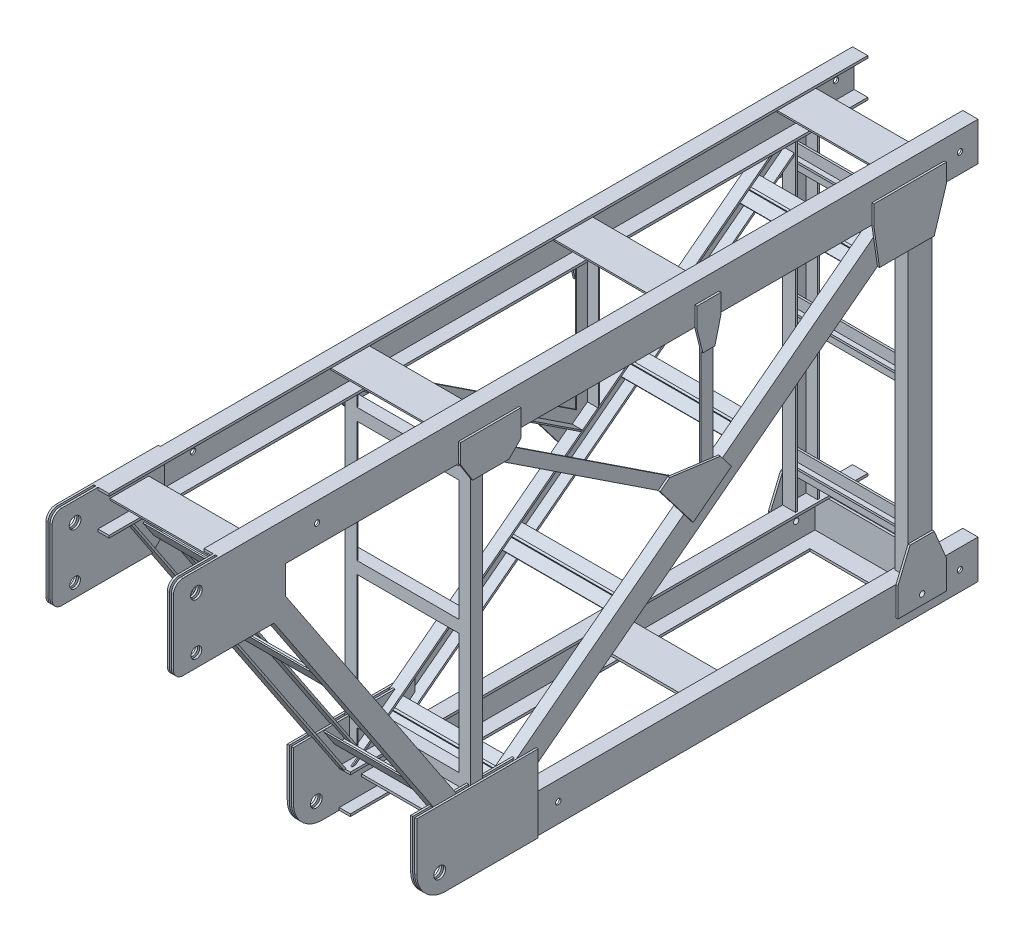
from build123d import *

# Parameters (mm, degrees)
EXTRUDE_1_DEPTH                   = 3335
EXTRUDE_1_2_DEPTH                 = 3335
PATTERN_LINEAR_2_COUNT            = 2
PATTERN_LINEAR_2_PITCH            = 1500
SKETCH_4_W                        = 520
SKETCH_4_H                        = 1000
CUT_EXTRUDE_2_DEPTH               = 1000
EXTRUDE_3_DEPTH                   = 520
SKETCH_8_W                        = 100
SKETCH_8_H                        = 1340
EXTRUDE_7_DEPTH                   = 520
CUT_EXTRUDE_9_DEPTH               = 1340
SKETCH_11_R                       = 11
CUT_EXTRUDE_10_DEPTH              = 3694.592424727
EXTRUDE_11_DEPTH                  = 48
PATTERN_LINEAR_3_COUNT            = 2
PATTERN_LINEAR_3_PITCH            = 472
CUT_EXTRUDE_12_DEPTH              = 42.7
CUT_EXTRUDE_13_DEPTH              = 42.7
EXTRUDE_14_DEPTH                  = 43
PATTERN_LINEAR_4_COUNT            = 2
PATTERN_LINEAR_4_PITCH            = 477
CUT_EXTRUDE_15_DEPTH              = 38
CUT_EXTRUDE_16_DEPTH              = 38
EXTRUDE_17_DEPTH                  = 520
SKETCH_19_W                       = 394
SKETCH_19_H                       = 50
CUT_EXTRUDE_18_DEPTH              = 3694.592424727
CUT_EXTRUDE_19_DEPTH              = 15
CUT_EXTRUDE_20_DEPTH              = 15
CUT_EXTRUDE_21_DEPTH              = 45
CUT_EXTRUDE_22_DEPTH              = 45
PATTERN_LINEAR_6_COUNT            = 4
PATTERN_LINEAR_6_PITCH            = 925
SKETCH_27_W                       = 520
SKETCH_27_H                       = 160
EXTRUDE_24_DEPTH                  = 10
SKETCH_28_W                       = 507
SKETCH_28_H                       = 10
EXTRUDE_25_DEPTH                  = 140
EXTRUDE_26_DEPTH                  = 520
PATTERN_LINEAR_9_COUNT            = 3
PATTERN_LINEAR_9_PITCH            = 550
EXTRUDE_27_DEPTH                  = 520
PATTERN_LINEAR_10_COUNT           = 4
PATTERN_LINEAR_10_PITCH           = 620
EXTRUDE_28_DEPTH                  = 520
SKETCH_32_W                       = 394
SKETCH_32_H                       = 5
EXTRUDE_29_DEPTH                  = 15
PATTERN_LINEAR_11_COUNT           = 3
PATTERN_LINEAR_11_PITCH           = 675
SKETCH_38_W                       = 520
SKETCH_38_H                       = 50
EXTRUDE_36_DEPTH                  = 50
SKETCH_38_2_W                     = 520
SKETCH_38_2_H                     = 50
EXTRUDE_37_DEPTH                  = 50
PATTERN_LINEAR_13_COUNT           = 3
PATTERN_LINEAR_13_PITCH           = 550
SKETCH_39_W                       = 514
SKETCH_39_H                       = 45
CUT_EXTRUDE_38_DEPTH              = 45
SKETCH_40_W                       = 503.521126761
SKETCH_40_H                       = 320
EXTRUDE_39_DEPTH                  = 8.5
PATTERN_LINEAR_15_COUNT           = 2
PATTERN_LINEAR_15_PITCH           = 17
PATTERN_LINEAR_16_COUNT           = 2
PATTERN_LINEAR_16_PITCH           = 511.5
PATTERN_LINEAR_16_COPY_1_SKETCH_W = 503.521126761
PATTERN_LINEAR_16_COPY_1_SKETCH_H = 320
PATTERN_LINEAR_16_COPY_1_DEPTH    = 8.5
SKETCH_41_W                       = 8.5
SKETCH_41_H                       = 160
SKETCH_41_W_2                     = 486
CUT_EXTRUDE_40_DEPTH              = 190
SKETCH_42_W                       = 160
SKETCH_42_H                       = 10
EXTRUDE_41_DEPTH                  = 501.5
FILLET_1_R                        = 120
SKETCH_43_R                       = 24.25
CUT_EXTRUDE_42_DEPTH              = 3697.024080008
SKETCH_44_W                       = 465
SKETCH_44_H                       = 350
EXTRUDE_43_DEPTH                  = 8.5
PATTERN_LINEAR_17_COUNT           = 2
PATTERN_LINEAR_17_PITCH           = 17
SKETCH_45_W                       = 8.5
SKETCH_45_H                       = 350
SKETCH_45_W_2                     = 496.5
CUT_EXTRUDE_44_DEPTH              = 190
CHAMFER_1_SIZE                    = 50
SKETCH_46_R                       = 24.25
CUT_EXTRUDE_45_DEPTH              = 3697.024080008
EXTRUDE_46_DEPTH                  = 8.5
PATTERN_LINEAR_19_COUNT           = 2
PATTERN_LINEAR_19_PITCH           = 528.5
PATTERN_LINEAR_20_COUNT           = 2
PATTERN_LINEAR_20_PITCH           = 950
EXTRUDE_48_DEPTH                  = 50
EXTRUDE_55_DEPTH                  = 50
PATTERN_LINEAR_21_COUNT           = 2
PATTERN_LINEAR_21_PITCH           = 470
CUT_EXTRUDE_56_DEPTH              = 45
CUT_EXTRUDE_57_DEPTH              = 45
CHAMFER_2_SIZE                    = 50
EXTRUDE_58_DEPTH                  = 8.5
PATTERN_LINEAR_22_COUNT           = 2
PATTERN_LINEAR_22_PITCH           = 528.5
CHAMFER_3_SIZE                    = 150
PATTERN_LINEAR_23_COUNT           = 2
PATTERN_LINEAR_23_PITCH           = 520
PATTERN_LINEAR_24_COUNT           = 2
PATTERN_LINEAR_24_PITCH           = 503
SKETCH_57_R                       = 24.25
SKETCH_57_R_2                     = 22.25
CUT_EXTRUDE_59_DEPTH              = 3695.798675165
FILLET_2_R                        = 40
SKETCH_58_R                       = 11
CUT_EXTRUDE_60_DEPTH              = 3697.024080008


with BuildPart() as part:
    # 草图2 → 拉伸1 (new body)
    with BuildSketch(Plane.XY):
        Polygon((0, 0), (0, 160), (63, 160), (63, 150), (6.5, 150), (6.5, 10), (63, 10), (63, 0), align=None)
    extrude_1 = extrude(amount=EXTRUDE_1_DEPTH)



with BuildPart() as body_2:
    # 草图2 → Extrude 1 2 (new body)
    with BuildSketch(Plane.XY):
        Polygon((457, 160), (520, 160), (520, 0), (457, 0), (457, 10), (513.5, 10), (513.5, 150), (457, 150), align=None)
    extrude_1_2 = extrude(amount=EXTRUDE_1_2_DEPTH)


with BuildPart() as pattern_linear_2_1:
    # 阵列(线性)2: pattern copy
    add(extrude_1.moved(Location(Vector(0, -1, 0) * (1 * PATTERN_LINEAR_2_PITCH))))


with BuildPart() as pattern_linear_2_2:
    # 阵列(线性)2: pattern copy
    add(extrude_1_2.moved(Location(Vector(0, -1, 0) * (1 * PATTERN_LINEAR_2_PITCH))))


with BuildPart() as cut_extrude_2_tool:
    # 草图4 → 拉伸2 (new body)
    with BuildSketch(Plane(origin=(0, -1340, 0), x_dir=(1, 0, 0), z_dir=(0, 1, 0))):
        with Locations((260, -2835)):
            Rectangle(SKETCH_4_W, SKETCH_4_H)
    extrude(amount=-CUT_EXTRUDE_2_DEPTH)


with BuildPart() as pattern_linear_2_1_1:
    add(pattern_linear_2_1.part)

    # 拉伸2: cut by cut_extrude_2_tool
    add(cut_extrude_2_tool.part, mode=Mode.SUBTRACT)


with BuildPart() as pattern_linear_2_2_1:
    add(pattern_linear_2_2.part)

    # 拉伸2: cut by cut_extrude_2_tool
    add(cut_extrude_2_tool.part, mode=Mode.SUBTRACT)


with BuildPart() as part_1:
    add(part.part)

    add(body_2.part)  # 拉伸3 merges body 2
    # 草图5 → 拉伸3 (add)
    with BuildSketch(Plane.ZY):
        Polygon((160, 95), (320, 95), (320, 88.5), (243.25, 88.5), (243.25, 48.5), (236.75, 48.5), (236.75, 88.5), (160, 88.5), align=None)
    extrude_3 = extrude(amount=-EXTRUDE_3_DEPTH)

    # 草图11 → 拉伸10 (cut, through all)
    with BuildSketch(Plane.ZY):
        with Locations((3240, 80)):
            Circle(SKETCH_11_R)
    extrude(amount=-CUT_EXTRUDE_10_DEPTH, mode=Mode.SUBTRACT)


    add(pattern_linear_2_1_1.part)  # 拉伸11 merges 阵列(线性)2_1


with BuildPart() as body_4:
    # 草图8 → 拉伸7 (new body)
    with BuildSketch(Plane.ZY):
        with Locations((240, -670)):
            Rectangle(SKETCH_8_W, SKETCH_8_H)
    extrude(amount=-EXTRUDE_7_DEPTH)

    # 草图10 → 拉伸9 (cut)
    with BuildSketch(Plane.XZ.offset(1340)):
        Polygon((466.7, 290), (466.7, 281.5), (514.7, 281.5), (514.7, 198.5), (466.7, 198.5), (466.7, 190), (53.3, 190), (53.3, 198.5), (5.3, 198.5), (5.3, 281.5), (53.3, 281.5), (53.3, 290), align=None)
    extrude(amount=-CUT_EXTRUDE_9_DEPTH, mode=Mode.SUBTRACT)


with BuildPart() as cut_extrude_9_piece_1:
    # of the separate pieces the step leaves, piece 1, a body of its own (cut_extrude_9_pieces)
    add(body_4.part.solids().sort_by_distance((466.7, 0, 198.5))[0])


with BuildPart() as cut_extrude_9_piece_2:
    # of the separate pieces the step leaves, piece 2, a body of its own (cut_extrude_9_pieces)
    add(body_4.part.solids().sort_by_distance((0, 0, 190))[0])


with BuildPart() as part_2:
    add(part_1.part)

    add(cut_extrude_9_piece_2.part)  # 拉伸11 merges 拉伸9 piece 2
    # 草图12 → 拉伸11 (add)
    with BuildSketch(Plane.ZY):
        Polygon((290, 0), (372.257507922, 0), (2122.750465669, -1340), (1958.235449824, -1340), (290, -62.968011455), align=None)
    extrude_11 = extrude(amount=-EXTRUDE_11_DEPTH)


    add(pattern_linear_2_2_1.part)  # 阵列(线性)3 merges 阵列(线性)2_2

    add(cut_extrude_9_piece_1.part)  # 阵列(线性)3 merges 拉伸9 piece 1
    # 阵列(线性)3: 拉伸11 ×2
    with Locations(*[(i * PATTERN_LINEAR_3_PITCH, 0, 0) for i in range(1, PATTERN_LINEAR_3_COUNT)]):
        add(extrude_11)

    # 草图13 → 拉伸12 (cut)
    with BuildSketch(Plane(origin=(48, 0, 0), x_dir=(0, 0, -1), z_dir=(1, 0, 0))):
        Polygon((-358.273731576, 0), (-290, 0), (-290, -52.263449508), (-1972.219226171, -1340), (-2108.766689322, -1340), align=None)
    extrude(amount=-CUT_EXTRUDE_12_DEPTH, mode=Mode.SUBTRACT)

    # 草图14 → 拉伸13 (cut)
    with BuildSketch(Plane.ZY.offset(-472)):
        Polygon((290, -52.263449508), (290, 0), (358.273731576, 0), (2108.766689322, -1340), (1972.219226171, -1340), align=None)
    extrude(amount=-CUT_EXTRUDE_13_DEPTH, mode=Mode.SUBTRACT)

    # 草图15 → 拉伸14 (add)
    with BuildSketch(Plane.ZY):
        Polygon((2996.666666667, 0), (2948.59264966, 0), (2078.064178211, -1305.792707175), (2122.750465669, -1340), (2151.40735034, -1340), (3044.740683673, 0), align=None)
    extrude_14 = extrude(amount=-EXTRUDE_14_DEPTH)

    # 阵列(线性)4: 拉伸14 ×2
    with Locations(*[(i * PATTERN_LINEAR_4_PITCH, 0, 0) for i in range(1, PATTERN_LINEAR_4_COUNT)]):
        add(extrude_14)

    # 草图16 → 拉伸15 (cut)
    with BuildSketch(Plane.ZY.offset(-477)):
        Polygon((2958.207453062, 0), (3035.125880272, 0), (2141.792546938, -1340), (2064.874119728, -1340), align=None)
    extrude(amount=-CUT_EXTRUDE_15_DEPTH, mode=Mode.SUBTRACT)

    # 草图17 → 拉伸16 (cut)
    with BuildSketch(Plane(origin=(43, 0, 0), x_dir=(0, 0, -1), z_dir=(1, 0, 0))):
        Polygon((-3035.125880272, 0), (-2958.207453062, 0), (-2064.874119728, -1340), (-2141.792546938, -1340), align=None)
    extrude(amount=-CUT_EXTRUDE_16_DEPTH, mode=Mode.SUBTRACT)

    # 阵列(线性)6: 拉伸3 ×4
    with Locations(*[(0, 0, i * PATTERN_LINEAR_6_PITCH) for i in range(1, PATTERN_LINEAR_6_COUNT)]):
        add(extrude_3)

    # 草图27 → 拉伸24 (add)
    with BuildSketch(Plane.XZ.offset(1500)):
        with Locations((260, 160)):
            Rectangle(SKETCH_27_W, SKETCH_27_H)
    extrude(amount=-EXTRUDE_24_DEPTH)

    # 草图28 → 拉伸25 (add)
    with BuildSketch(Plane(origin=(0, -1490, 0), x_dir=(1, 0, 0), z_dir=(0, 1, 0))):
        with Locations((260, -157.5)):
            Rectangle(SKETCH_28_W, SKETCH_28_H)
    extrude(amount=EXTRUDE_25_DEPTH)

    # 草图29 → 拉伸26 (add)
    with BuildSketch(Plane.ZY):
        Polygon((231.5, -1160), (231.5, -1260), (240, -1260), (240, -1214.25), (260, -1214.25), (260, -1205.75), (240, -1205.75), (240, -1160), align=None)
    extrude_26 = extrude(amount=-EXTRUDE_26_DEPTH)

    # 阵列(线性)9: 拉伸26 ×3
    with Locations(*[(0, i * PATTERN_LINEAR_9_PITCH, 0) for i in range(1, PATTERN_LINEAR_9_COUNT)]):
        add(extrude_26)

    # 草图30 → 拉伸27 (add)
    with BuildSketch(Plane.ZY):
        Polygon((400.222762047, -95.079937746), (479.628159874, -155.864662767), (484.794861501, -149.115203952), (448.466891995, -121.306192255), (460.623836999, -105.425112689), (453.874378184, -100.258411062), (441.717433179, -116.139490628), (405.389463673, -88.330478931), align=None)
    extrude_27 = extrude(amount=-EXTRUDE_27_DEPTH)

    # 阵列(线性)10: 拉伸27 ×4
    with Locations(*[Vector(0, -0.6078472502130496, 0.7940539782712724) * (i * PATTERN_LINEAR_10_PITCH) for i in range(1, PATTERN_LINEAR_10_COUNT)]):
        add(extrude_27)

    # 草图31 → 拉伸28 (add)
    with BuildSketch(Plane(origin=(520, 0, 0), x_dir=(0, 0, -1), z_dir=(1, 0, 0))):
        Polygon((-2953.908526541, -59.630271094), (-2909.532510843, -126.194294641), (-2913.692762315, -128.967795622), (-2958.068778013, -62.403772075), align=None)
    extrude_28 = extrude(amount=-EXTRUDE_28_DEPTH)

    # 草图32 → 拉伸29 (add)
    with BuildSketch(Plane(origin=(0, -1381.690172586, 2072.53525888), x_dir=(-1, 0, 0), z_dir=(0, 0.5547001962252277, -0.8320502943378447))):
        with Locations((-260, 1548.918254688)):
            Rectangle(SKETCH_32_W, SKETCH_32_H)
    extrude_29 = extrude(amount=EXTRUDE_29_DEPTH)

    # 阵列(线性)11: 拉伸28, 拉伸29 ×3
    with Locations(*[Vector(0, -0.8320502943378439, -0.5547001962252288) * (i * PATTERN_LINEAR_11_PITCH) for i in range(1, PATTERN_LINEAR_11_COUNT)]):
        add(extrude_28)
        add(extrude_29)


with BuildPart() as body_2_2:
    # 草图18 → 拉伸17 (new body)
    with BuildSketch(Plane.ZY):
        Polygon((2053.064178211, 0), (2103.064178211, 0), (2103.064178211, -1268.292707175), (2078.064178211, -1305.792707175), (2053.064178211, -1286.655240868), align=None)
    extrude(amount=-EXTRUDE_17_DEPTH)

    # 草图19 → 拉伸18 (cut, through all)
    with BuildSketch(Plane(origin=(0, 0, 0), x_dir=(1, 0, 0), z_dir=(0, 1, 0))):
        with Locations((260, -2078.064178211)):
            Rectangle(SKETCH_19_W, SKETCH_19_H)
    extrude(amount=-CUT_EXTRUDE_18_DEPTH, mode=Mode.SUBTRACT)


with BuildPart() as cut_extrude_18_piece_1:
    # of the separate pieces the step leaves, piece 1, a body of its own (cut_extrude_18_pieces)
    add(body_2_2.part.solids().sort_by_distance((0, 0, 2053.064178211))[0])

    # 草图21 → 拉伸20 (cut)
    with BuildSketch(Plane(origin=(63, 0, 0), x_dir=(0, 0, -1), z_dir=(1, 0, 0))):
        Polygon((-2103.064178211, -1268.292707175), (-2078.064178211, -1305.792707175), (-2053.064178211, -1286.655240868), (-2053.064178211, 0), (-2103.064178211, 0), align=None)
    extrude(amount=-CUT_EXTRUDE_20_DEPTH, mode=Mode.SUBTRACT)

    # 草图24 → 拉伸22 (cut)
    with BuildSketch(Plane(origin=(48, 0, 0), x_dir=(0, 0, -1), z_dir=(1, 0, 0))):
        Polygon((-2098.064178211, -1275.792707175), (-2078.064178211, -1305.792707175), (-2053.064178211, -1286.655240868), (-2053.064178211, 0), (-2098.064178211, 0), align=None)
    extrude(amount=-CUT_EXTRUDE_22_DEPTH, mode=Mode.SUBTRACT)


with BuildPart() as cut_extrude_18_piece_2:
    # of the separate pieces the step leaves, piece 2, a body of its own (cut_extrude_18_pieces)
    add(body_2_2.part.solids().sort_by_distance((457, 0, 2103.064178211))[0])

    # 草图20 → 拉伸19 (cut)
    with BuildSketch(Plane.ZY.offset(-457)):
        Polygon((2053.064178211, 0), (2103.064178211, 0), (2103.064178211, -1268.292707175), (2078.064178211, -1305.792707175), (2053.064178211, -1286.655240868), align=None)
    extrude(amount=-CUT_EXTRUDE_19_DEPTH, mode=Mode.SUBTRACT)

    # 草图23 → 拉伸21 (cut)
    with BuildSketch(Plane.ZY.offset(-472)):
        Polygon((2098.064178211, -1275.792707175), (2078.064178211, -1305.792707175), (2053.064178211, -1286.655240868), (2053.064178211, 0), (2098.064178211, 0), align=None)
    extrude(amount=-CUT_EXTRUDE_21_DEPTH, mode=Mode.SUBTRACT)


    add(cut_extrude_18_piece_1.part)  # 拉伸36 merges 拉伸18 piece 1

    add(part_2.part)  # 拉伸36 merges part
    # 草图38 → 拉伸36 (add)
    with BuildSketch(Plane.XY.offset(2103.064178211)):
        with Locations((260, -1183.292707175)):
            Rectangle(SKETCH_38_W, SKETCH_38_H)
    extrude(amount=-EXTRUDE_36_DEPTH)

    # 草图38<2> → 拉伸37 (add)
    with BuildSketch(Plane.XY.offset(2103.064178211)):
        with Locations((260, -1183.292707175)):
            Rectangle(SKETCH_38_2_W, SKETCH_38_2_H)
    extrude_37 = extrude(amount=-EXTRUDE_37_DEPTH)

    # 阵列(线性)13: 拉伸37 ×3
    with Locations(*[(0, i * PATTERN_LINEAR_13_PITCH, 0) for i in range(1, PATTERN_LINEAR_13_COUNT)]):
        add(extrude_37)

    # 草图39 → 拉伸38 (cut)
    with BuildSketch(Plane(origin=(0, 0, 2053.064178211), x_dir=(-1, 0, 0), z_dir=(0, 0, -1))):
        with Locations((-260, -1185.792707175)):
            Rectangle(SKETCH_39_W, SKETCH_39_H)
        with Locations((-260, -635.792707175)):
            Rectangle(SKETCH_39_W, SKETCH_39_H)
        with Locations((-260, -85.792707175)):
            Rectangle(SKETCH_39_W, SKETCH_39_H)
    extrude(amount=-CUT_EXTRUDE_38_DEPTH, mode=Mode.SUBTRACT)

    # 草图40 → 拉伸39 (add)
    with BuildSketch(Plane(origin=(520, 0, 0), x_dir=(0, 0, -1), z_dir=(1, 0, 0))):
        with Locations((-2083.23943662, -1340)):
            Rectangle(SKETCH_40_W, SKETCH_40_H)
    extrude_39 = extrude(amount=EXTRUDE_39_DEPTH)

    # 阵列(线性)15: 拉伸39 ×2
    with Locations(*[(-i * PATTERN_LINEAR_15_PITCH, 0, 0) for i in range(1, PATTERN_LINEAR_15_COUNT)]):
        add(extrude_39)

    # 阵列(线性)16: 拉伸39 ×2
    with Locations(*[(-i * PATTERN_LINEAR_16_PITCH, 0, 0) for i in range(1, PATTERN_LINEAR_16_COUNT)]):
        add(extrude_39)

    # 阵列(线性)16 copy 1 sketch → 阵列(线性)16 copy 1 (add)
    with BuildSketch(Plane(origin=(-8.5, 0, 0), x_dir=(0, 0, -1), z_dir=(1, 0, 0))):
        with Locations((-2083.23943662, -1340)):
            Rectangle(PATTERN_LINEAR_16_COPY_1_SKETCH_W, PATTERN_LINEAR_16_COPY_1_SKETCH_H)
    extrude(amount=PATTERN_LINEAR_16_COPY_1_DEPTH)

    # 草图41 → 拉伸40 (cut)
    with BuildSketch(Plane.XY.offset(2335)):
        with Locations((4.25, -1420)):
            Rectangle(SKETCH_41_W, SKETCH_41_H)
        with Locations((260, -1420)):
            Rectangle(SKETCH_41_W_2, SKETCH_41_H)
        with Locations((515.75, -1420)):
            Rectangle(SKETCH_41_W, SKETCH_41_H)
    extrude(amount=-CUT_EXTRUDE_40_DEPTH, mode=Mode.SUBTRACT)

    # 草图42 → 拉伸41 (add)
    with BuildSketch(Plane.ZY.offset(-503)):
        with Locations((1973.064178211, -1420)):
            Rectangle(SKETCH_42_W, SKETCH_42_H)
    extrude_41 = extrude(amount=EXTRUDE_41_DEPTH)

    # 圆角1
    fillet_1_edges = [cut_extrude_18_piece_2.edges().sort_by_distance(p)[0] for p in [
        (524.25, -1500, 2335),
        (-4.25, -1500, 2335),
        (12.75, -1500, 2335),
        (507.25, -1500, 2335),
    ]]
    fillet(fillet_1_edges, radius=FILLET_1_R)

    # 草图43 → 拉伸42 (cut, through all)
    with BuildSketch(Plane.ZY.offset(8.5)):
        with Locations((2240, -1420)):
            Circle(SKETCH_43_R)
    extrude(amount=-CUT_EXTRUDE_42_DEPTH, mode=Mode.SUBTRACT)

    # 草图44 → 拉伸43 (add)
    with BuildSketch(Plane.ZY):
        with Locations((3102.5, -15)):
            Rectangle(SKETCH_44_W, SKETCH_44_H)
    extrude_43 = extrude(amount=EXTRUDE_43_DEPTH)

    # 阵列(线性)17: 拉伸43 ×2
    with Locations(*[(i * PATTERN_LINEAR_17_PITCH, 0, 0) for i in range(1, PATTERN_LINEAR_17_COUNT)]):
        add(extrude_43)

    # 草图45 → 拉伸44 (cut)
    with BuildSketch(Plane.XY.offset(3335)):
        with Locations((4.25, -15)):
            Rectangle(SKETCH_45_W, SKETCH_45_H)
        with Locations((265.25, -15)):
            Rectangle(SKETCH_45_W_2, SKETCH_45_H)
    extrude(amount=-CUT_EXTRUDE_44_DEPTH, mode=Mode.SUBTRACT)

    # 倒角1
    # the kernel refuses this chamfer: 50 mm, written as the material it takes off along each edge
    with BuildSketch(Plane(origin=(128.584149398, -190, 2870), x_dir=(0, 0.9996219169112969, -0.02749587661058217), z_dir=(-1, 0, 0))) as chamfer_1_piece_1_section:
        Polygon((CHAMFER_1_SIZE * 0.999621916911, -CHAMFER_1_SIZE * 0.0274958766106), (-CHAMFER_1_SIZE * 0.0274958766106, -CHAMFER_1_SIZE * 0.999621916911), (0, 0), align=None)
    chamfer_1_piece_1 = extrude(amount=265.668298797, mode=Mode.PRIVATE)
    chamfer_1_piece_1 = split(chamfer_1_piece_1, bisect_by=Plane(origin=(8.5, -172.859199894, 2885.769211679), z_dir=(1, 0, 0)), keep=Keep.TOP, mode=Mode.PRIVATE)
    chamfer_1_piece_1 = split(chamfer_1_piece_1, bisect_by=Plane(origin=(12.75, -188.605600815, 2909.388813062), z_dir=(0, 0.554700196225229, -0.8320502943378437)), keep=Keep.TOP, mode=Mode.PRIVATE)
    add(chamfer_1_piece_1, mode=Mode.SUBTRACT)
    with BuildSketch(Plane(origin=(0, -190, 2870), x_dir=(0, 0.9996219169112969, -0.02749587661058217), z_dir=(-1, 0, 0))) as chamfer_1_piece_2:
        Polygon((CHAMFER_1_SIZE * 0.999621916911, -CHAMFER_1_SIZE * 0.0274958766106), (-CHAMFER_1_SIZE * 0.0274958766106, -CHAMFER_1_SIZE * 0.999621916911), (0, 0), align=None)
    extrude(amount=137.084149398, mode=Mode.SUBTRACT)
    with BuildSketch(Plane(origin=(145.584149398, -190, 2870), x_dir=(0, 0.9996219169112969, -0.02749587661058217), z_dir=(-1, 0, 0))) as chamfer_1_piece_3_section:
        Polygon((CHAMFER_1_SIZE * 0.999621916911, -CHAMFER_1_SIZE * 0.0274958766106), (-CHAMFER_1_SIZE * 0.0274958766106, -CHAMFER_1_SIZE * 0.999621916911), (0, 0), align=None)
    chamfer_1_piece_3 = extrude(amount=137.084149398, mode=Mode.PRIVATE)
    chamfer_1_piece_3 = split(chamfer_1_piece_3, bisect_by=Plane(origin=(12.75, -188.605600815, 2909.388813062), z_dir=(0, 0.554700196225229, -0.8320502943378437)), keep=Keep.TOP, mode=Mode.PRIVATE)
    add(chamfer_1_piece_3, mode=Mode.SUBTRACT)
    with BuildSketch(Plane(origin=(145.584149398, -190, 2870), x_dir=(0, 0.9996219169112969, -0.02749587661058217), z_dir=(-1, 0, 0))) as chamfer_1_piece_4_section:
        Polygon((CHAMFER_1_SIZE * 0.999621916911, -CHAMFER_1_SIZE * 0.0274958766106), (-CHAMFER_1_SIZE * 0.0274958766106, -CHAMFER_1_SIZE * 0.999621916911), (0, 0), align=None)
    chamfer_1_piece_4 = extrude(amount=265.668298797, mode=Mode.PRIVATE)
    chamfer_1_piece_4 = split(chamfer_1_piece_4, bisect_by=Plane(origin=(0, -172.859199894, 2885.769211679), z_dir=(-1, 0, 0)), keep=Keep.TOP, mode=Mode.PRIVATE)
    add(chamfer_1_piece_4, mode=Mode.SUBTRACT)

    # 草图46 → 拉伸45 (cut, through all)
    with BuildSketch(Plane.ZY.offset(8.5)):
        with Locations(Location((3240, 80, 0), (0, 0, 90))):
            Circle(SKETCH_46_R)
    extrude(amount=-CUT_EXTRUDE_45_DEPTH, mode=Mode.SUBTRACT)

    # 草图47 → 拉伸46 (add)
    with BuildSketch(Plane.ZY):
        Polygon((140, 80), (140, 0), (190, -160), (416.756576585, -160), (440, 0), (440, 80), align=None)
        Polygon((140, -1460), (340, -1460), (340, -1340), (290, -1220), (190, -1220), (140, -1340), align=None)
        Polygon((1903.064178211, 80), (2153.064178211, 80), (2153.064178211, 0), (2103.064178211, -80), (1903.064178211, -80), align=None)
    extrude_46 = extrude(amount=EXTRUDE_46_DEPTH)

    # 阵列(线性)19: 拉伸46 ×2
    with Locations(*[(i * PATTERN_LINEAR_19_PITCH, 0, 0) for i in range(1, PATTERN_LINEAR_19_COUNT)]):
        add(extrude_46)

    # 阵列(线性)20: 拉伸41 ×2
    with Locations(*[(0, 0, -i * PATTERN_LINEAR_20_PITCH) for i in range(1, PATTERN_LINEAR_20_COUNT)]):
        add(extrude_41)

    # 草图50 → 拉伸48 (add)
    with BuildSketch(Plane.ZY):
        Polygon((1099.117724912, 0), (1149.117724912, 0), (1149.117724912, -594.685449124), (1099.117724912, -556.41051651), align=None)
    extrude_48 = extrude(amount=-EXTRUDE_48_DEPTH)

    # 草图53 → 拉伸55 (add)
    with BuildSketch(Plane.ZY):
        Polygon((1149.117724912, -566.585052361), (2007.675606684, 0), (2053.064178211, 0), (2098.452749737, 0), (1171.430956753, -611.766198027), (1149.117724912, -594.685449124), align=None)
    extrude_55 = extrude(amount=-EXTRUDE_55_DEPTH)

    # 阵列(线性)21: 拉伸48, 拉伸55 ×2
    with Locations(*[(i * PATTERN_LINEAR_21_PITCH, 0, 0) for i in range(1, PATTERN_LINEAR_21_COUNT)]):
        add(extrude_48)
        add(extrude_55)

    # 草图54 → 拉伸56 (cut)
    with BuildSketch(Plane.ZY.offset(-470)):
        Polygon((1149.117724912, 0), (1104.117724912, 0), (1104.117724912, -560.238009771), (1167.228263991, -608.549042381), (2089.375035432, 0), (2007.675606684, 0), (1149.117724912, -566.585052361), align=None)
    extrude(amount=-CUT_EXTRUDE_56_DEPTH, mode=Mode.SUBTRACT)

    # 草图55 → 拉伸57 (cut)
    with BuildSketch(Plane(origin=(50, 0, 0), x_dir=(0, 0, -1), z_dir=(1, 0, 0))):
        Polygon((-1104.117724912, 0), (-1149.117724912, 0), (-1149.117724912, -566.585052361), (-2007.675606684, 0), (-2089.375035432, 0), (-1167.228263991, -608.549042381), (-1104.117724912, -560.238009771), align=None)
    extrude(amount=-CUT_EXTRUDE_57_DEPTH, mode=Mode.SUBTRACT)

    # 倒角2
    # the kernel refuses this chamfer: 50 mm, written as the material it takes off along each edge
    with BuildSketch(Plane(origin=(0, -80, 1903.064178211), x_dir=(0, 0.9996219169112966, -0.027495876610586594), z_dir=(-1, 0, 0)), Plane(origin=(657.084149398, -80, 1903.064178211), x_dir=(0, 0.9996219169112966, -0.027495876610586594), z_dir=(-1, 0, 0))) as chamfer_2_piece_1:
        Polygon((CHAMFER_2_SIZE * 0.999621916911, -CHAMFER_2_SIZE * 0.0274958766106), (-CHAMFER_2_SIZE * 0.0274958766106, -CHAMFER_2_SIZE * 0.999621916911), (0, 0), align=None)
    extrude(amount=137.084149398, mode=Mode.SUBTRACT)

    # 草图56 → 拉伸58 (add)
    with BuildSketch(Plane.ZY):
        Polygon((1074.117724912, 80), (1174.117724912, 80), (1174.117724912, 0), (1149.117724912, -100), (1099.117724912, -100), (1074.117724912, 0), align=None)
        Polygon((1030.466680395, -566.826245909), (1189.277476049, -688.395695951), (1326.043107347, -509.73355084), (1167.232311693, -388.164100798), align=None)
    extrude_58 = extrude(amount=EXTRUDE_58_DEPTH)

    # 阵列(线性)22: 拉伸58 ×2
    with Locations(*[(i * PATTERN_LINEAR_22_PITCH, 0, 0) for i in range(1, PATTERN_LINEAR_22_COUNT)]):
        add(extrude_58)

    # 倒角3
    # the kernel refuses this chamfer: 150 mm, written as the material it takes off along each edge
    with BuildSketch(Plane(origin=(0, -388.164100798, 1167.232311693), x_dir=(0, -0.7770404669006279, -0.6294506436559217), z_dir=(-1, 0, 0)), Plane(origin=(914.252448195, -388.164100798, 1167.232311693), x_dir=(0, -0.7770404669006279, -0.6294506436559217), z_dir=(-1, 0, 0))) as chamfer_3_piece_1:
        Polygon((CHAMFER_3_SIZE * 0.999621916911, CHAMFER_3_SIZE * 0.0274958766106), (-CHAMFER_3_SIZE * 0.0274958766106, CHAMFER_3_SIZE * 0.999621916911), (0, 0), align=None)
    extrude(amount=394.252448195, mode=Mode.SUBTRACT)

    # 阵列(线性)23: 拉伸43 ×2
    with Locations(*[(i * PATTERN_LINEAR_23_PITCH, 0, 0) for i in range(1, PATTERN_LINEAR_23_COUNT)]):
        add(extrude_43)

    # 阵列(线性)24: 拉伸43 ×2
    with Locations(*[(i * PATTERN_LINEAR_24_PITCH, 0, 0) for i in range(1, PATTERN_LINEAR_24_COUNT)]):
        add(extrude_43)

    # 草图57 → 拉伸59 (cut, through all)
    with BuildSketch(Plane(origin=(520, 0, 0), x_dir=(0, 0, -1), z_dir=(1, 0, 0))):
        with Locations(Location((-3240, 80, 0), (0, 0, 90))):
            Circle(SKETCH_57_R)
        with Locations(Location((-3240, -135, 0), (0, 0, 90))):
            Circle(SKETCH_57_R_2)
    extrude(amount=-CUT_EXTRUDE_59_DEPTH, mode=Mode.SUBTRACT)

    # 圆角2
    fillet_2_edges = [cut_extrude_18_piece_2.edges().sort_by_distance(p)[0] for p in [
        (-4.25, -190, 3335),
        (12.75, -190, 3335),
        (-4.25, 160, 3335),
        (12.75, 160, 3335),
        (515.75, 160, 3335),
        (515.75, -190, 3335),
        (498.75, 160, 3335),
        (498.75, -190, 3335),
    ]]
    fillet(fillet_2_edges, radius=FILLET_2_R)

    # 草图58 → 拉伸60 (cut, through all)
    with BuildSketch(Plane(origin=(528.5, 0, 0), x_dir=(0, 0, -1), z_dir=(1, 0, 0))):
        with Locations(Location((-2740, 80, 0), (0, 0, 270))):
            Circle(SKETCH_58_R)
        with Locations((-1740, -1420)):
            Circle(SKETCH_58_R)
        with Locations((-240, -1420)):
            Circle(SKETCH_58_R)
        with Locations(Location((-75, -1420, 0), (0, 0, 270))):
            Circle(SKETCH_58_R)
        with Locations(Location((-75, 80, 0), (0, 0, 270))):
            Circle(SKETCH_58_R)
    extrude(amount=-CUT_EXTRUDE_60_DEPTH, mode=Mode.SUBTRACT)


solid = cut_extrude_18_piece_2.part
